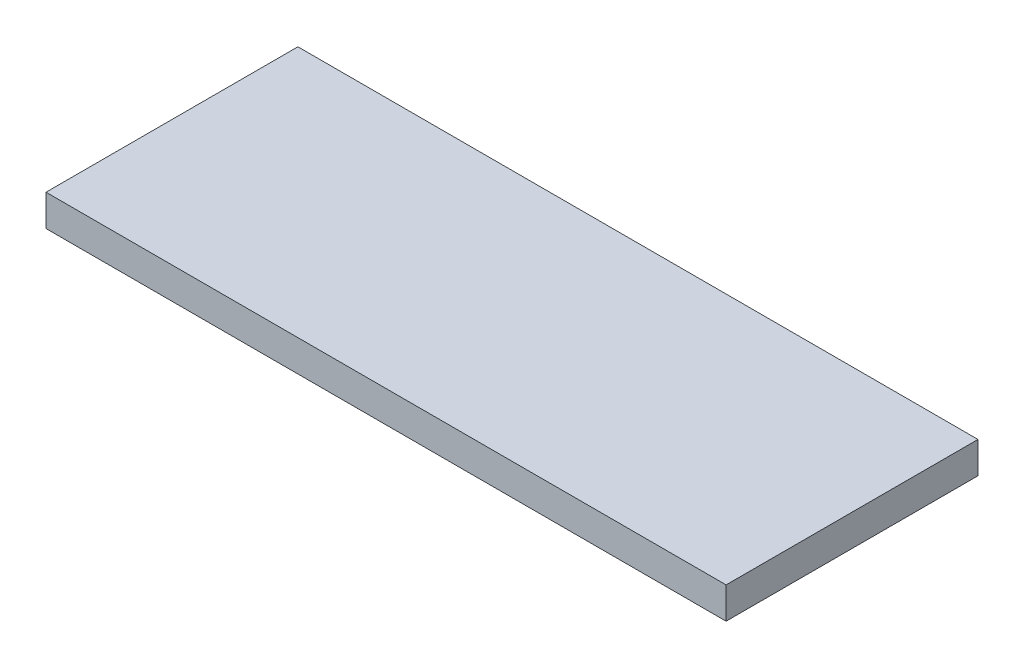
from build123d import *

# Parameters (mm, degrees)
SKETCH1_W           = 68.58
SKETCH1_H           = 25.4
BOSS_EXTRUDE1_DEPTH = 3.175


with BuildPart() as part:
    # Sketch1 → Boss-Extrude1 (new body)
    with BuildSketch(Plane(origin=(0, 0, 0), x_dir=(1, 0, 0), z_dir=(0, 1, 0))):
        with Locations((34.29, 12.7)):
            Rectangle(SKETCH1_W, SKETCH1_H)
    extrude(amount=BOSS_EXTRUDE1_DEPTH)


solid = part.part
